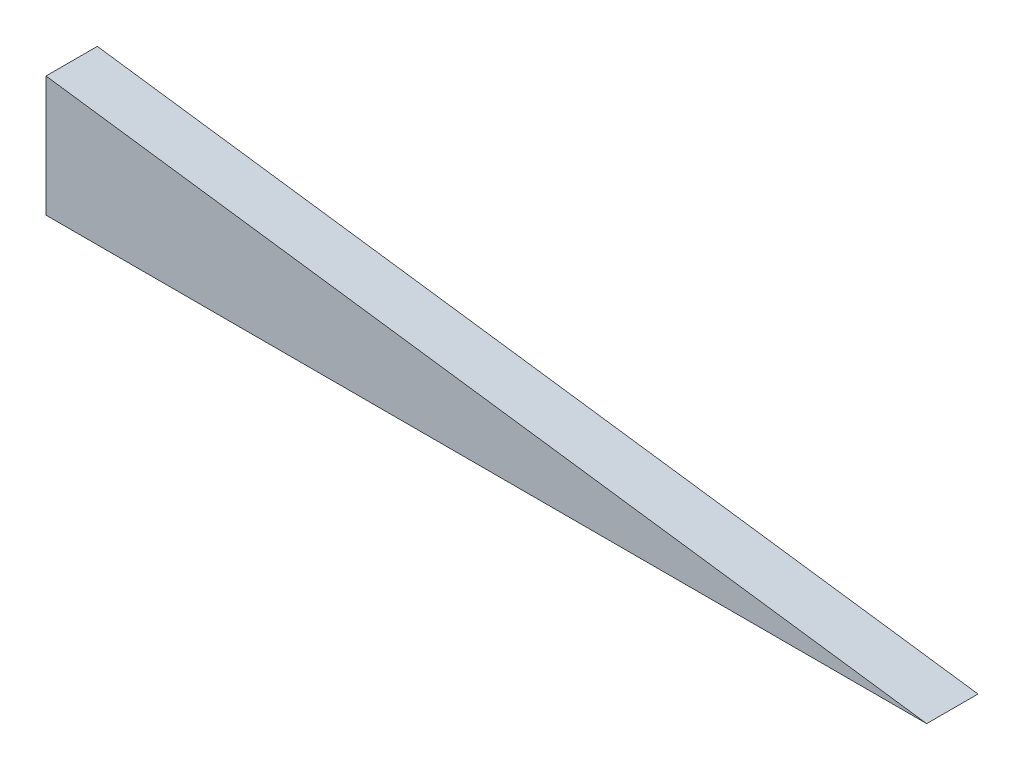
from build123d import *

# Parameters (mm, degrees)
BOSS_EXTRUDE1_DEPTH = 3.175


with BuildPart() as part:
    # Sketch1 → Boss-Extrude1 (new, symmetric)
    with BuildSketch(Plane.XY):
        Polygon((0, 0), (-108.966, 0), (-108.966, 14.914796948), align=None)
    extrude(amount=BOSS_EXTRUDE1_DEPTH, both=True)


solid = part.part
